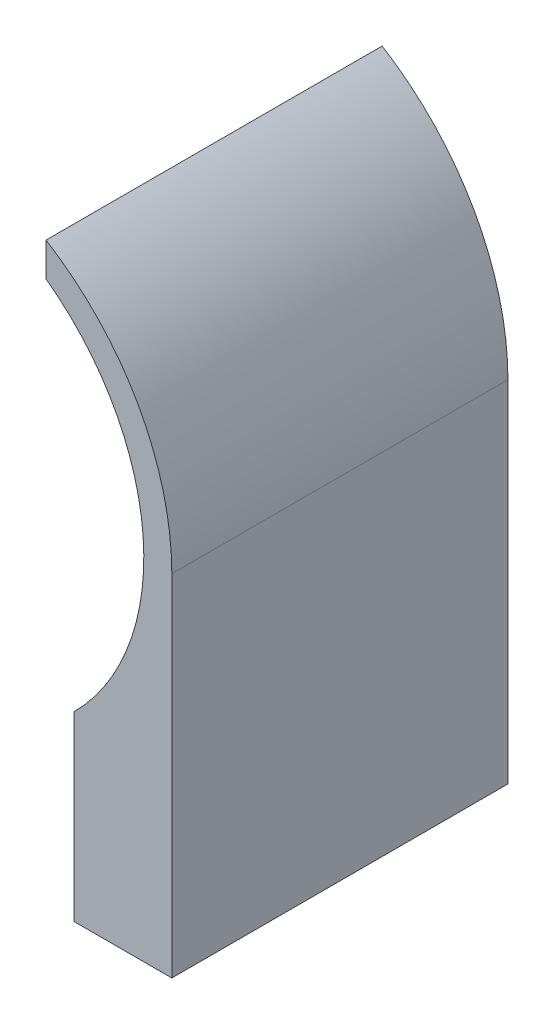
from build123d import *

# Parameters (mm, degrees)
INNER_RING_RIGHT_SIDE_DEPTH = 120


with BuildPart() as part:
    # Sketch2 → Inner Ring - Right Side (new body)
    with BuildSketch(Plane.XY):
        with BuildLine():
            Line((60, -60.207972894), (60, -125))
            Line((60, -125), (95, -125))
            Line((95, -125), (95, 0))
            ThreePointArc((95, 0), (83.019576005, 46.181706335), (50.1, 80.715487981))
            Line((50.1, 80.715487981), (50.1, 68.665784784))
            ThreePointArc((50.1, 68.665784784), (84.750302976, 6.510464307), (60, -60.207972894))
        make_face()
    extrude(amount=INNER_RING_RIGHT_SIDE_DEPTH)


solid = part.part
